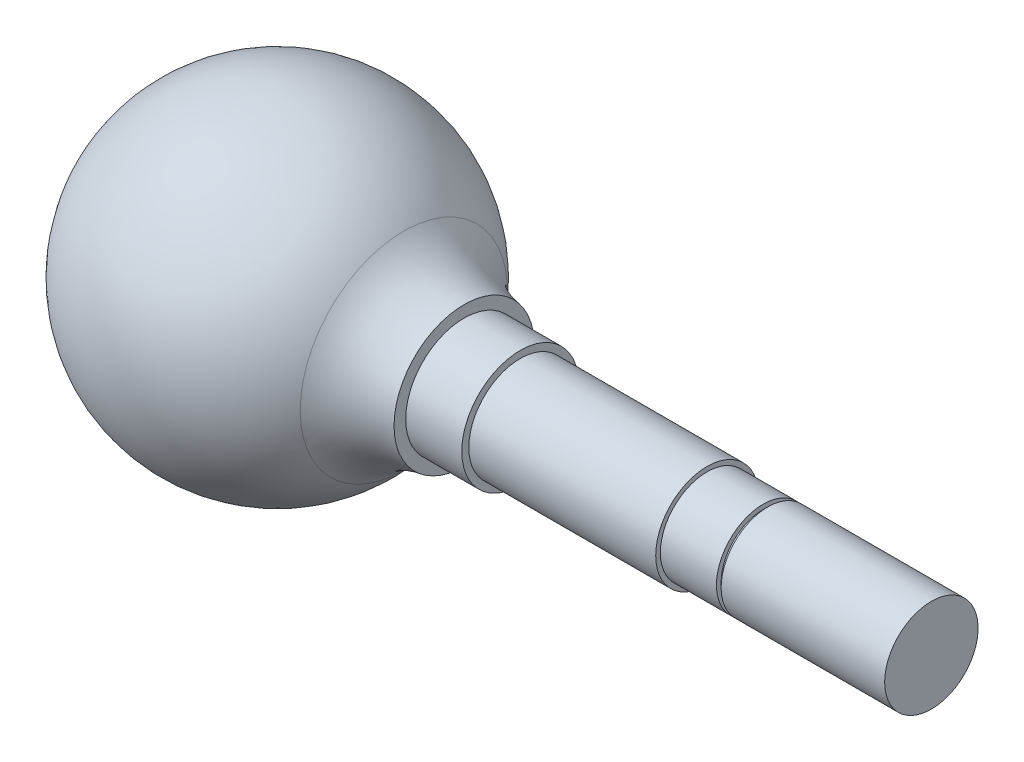
from build123d import *

# Parameters (mm, degrees)
FILLET1_R = 20


with BuildPart() as part:
    # Sketch1 → Revolve1 (revolve)
    with BuildSketch(Plane.XY):
        with BuildLine():
            Line((0, 35), (0, -35))
            ThreePointArc((0, -35), (-35, 0), (0, 35))
        make_face()
    revolve(axis=Axis((0, 35, 0), (0, -1, 0)))

    # Sketch2 → Revolve2 (revolve)
    with BuildSketch(Plane.XY, mode=Mode.PRIVATE) as revolve2_sk:
        with BuildLine():
            Line((52, 11), (92, 11))
            Line((92, 11), (92, 10))
            Line((92, 10), (104, 10))
            Line((104, 10), (104, 9))
            Line((104, 9), (105, 9))
            Line((105, 9), (105, 10))
            Line((105, 10), (140, 10))
            Line((140, 10), (140, 0))
            Line((140, 0), (35, 0))
            ThreePointArc((35, 0), (34.145257219, 7.687744108), (31.622776602, 15))
            Line((31.622776602, 15), (40, 15))
            Line((40, 15), (40, 12.5))
            Line((40, 12.5), (52, 12.5))
            Line((52, 12.5), (52, 11))
        make_face()
    revolve(revolve2_sk.sketch.rotate(Axis((0, 0, 0), (1, 0, 0)), 90), axis=Axis((0, 0, 0), (1, 0, 0)))

    # Fillet1
    # the kernel refuses this fillet: 20 mm, written as the material it adds along each edge
    with BuildSketch(Plane(origin=(31.622776602, 0, 0), x_dir=(0, 0, 1), z_dir=(0, 1, 0))) as fillet1_piece_1:
        with BuildLine():
            CenterArc((34.835253557, 10.939003315), FILLET1_R, 187.359176617, 43.341758227)
            Line((15, 8.377223398), (14.603294929, 8.3259878))
            ThreePointArc((14.603294929, 8.3259878), (14.6, 4.188611699), (14.6, 0))
            Line((14.6, 0), (14.828571429, -0.361403161))
            ThreePointArc((14.828571429, -0.361403161), (18.507983606, -2.388985489), (21.914541328, -4.847547782))
            Line((21.914541328, -4.847547782), (22.167888627, -4.538007564))
        make_face()
    revolve(axis=Axis((31.622776602, 0, 0), (1, 0, 0)))


solid = part.part
